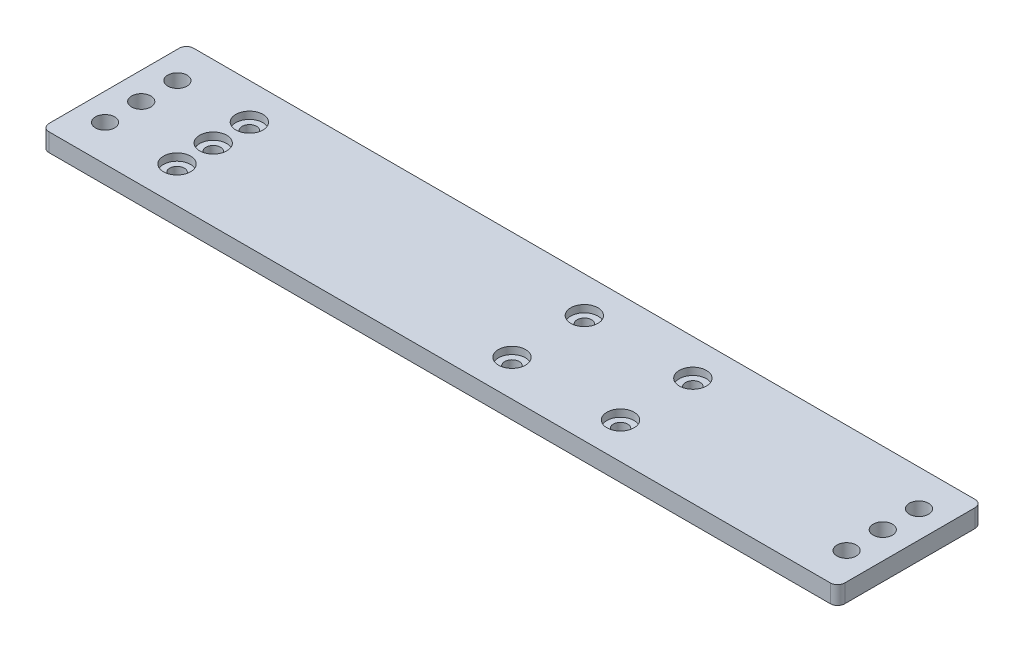
from build123d import *

# Parameters (mm, degrees)
SKETCH1_W                                       = 279.4
SKETCH1_H                                       = 50.8
BOSS_EXTRUDE1_DEPTH                             = 6.35
CBORE_FOR_10_SOCKET_HEAD_CAP_SCREW1_D           = 5.1054
CBORE_FOR_10_SOCKET_HEAD_CAP_SCREW1_CBORE_D     = 9.525
CBORE_FOR_10_SOCKET_HEAD_CAP_SCREW1_CBORE_DEPTH = 2.54
F_1_4_CLEARANCE_HOLE1_D                         = 6.7564
FILLET1_R                                       = 2.54


with BuildPart() as part:
    # Sketch1 → Boss-Extrude1 (new body)
    with BuildSketch(Plane(origin=(0, 0, 0), x_dir=(1, 0, 0), z_dir=(0, 1, 0))):
        Rectangle(SKETCH1_W, SKETCH1_H)
    extrude(amount=BOSS_EXTRUDE1_DEPTH)

    # CBORE for #10 Socket Head Cap Screw1 (through all)
    with Locations(Plane(origin=(0, 6.35, 0), x_dir=(1, 0, 0), z_dir=(0, 1, 0))):
        with Locations((50.8, 12.7), (12.7, 12.7), (12.7, -12.7), (50.8, -12.7), (-104.902, 12.7), (-104.902, 0), (-104.902, -12.7)):
            CounterBoreHole(CBORE_FOR_10_SOCKET_HEAD_CAP_SCREW1_D / 2, CBORE_FOR_10_SOCKET_HEAD_CAP_SCREW1_CBORE_D / 2, CBORE_FOR_10_SOCKET_HEAD_CAP_SCREW1_CBORE_DEPTH)

    # 1/4 Clearance Hole1 (through all)
    with Locations(Plane.XZ):
        with Locations((-130.175, 12.7), (-130.175, 0), (-130.175, -12.7), (130.175, 12.7), (130.175, 0), (130.175, -12.7)):
            Hole(F_1_4_CLEARANCE_HOLE1_D / 2)

    # Fillet1
    fillet1_edges = [part.edges().sort_by_distance(p)[0] for p in [
        (139.7, 3.175, -25.4),
        (139.7, 3.175, 25.4),
        (-139.7, 3.175, 25.4),
        (-139.7, 3.175, -25.4),
    ]]
    fillet(fillet1_edges, radius=FILLET1_R)


solid = part.part
